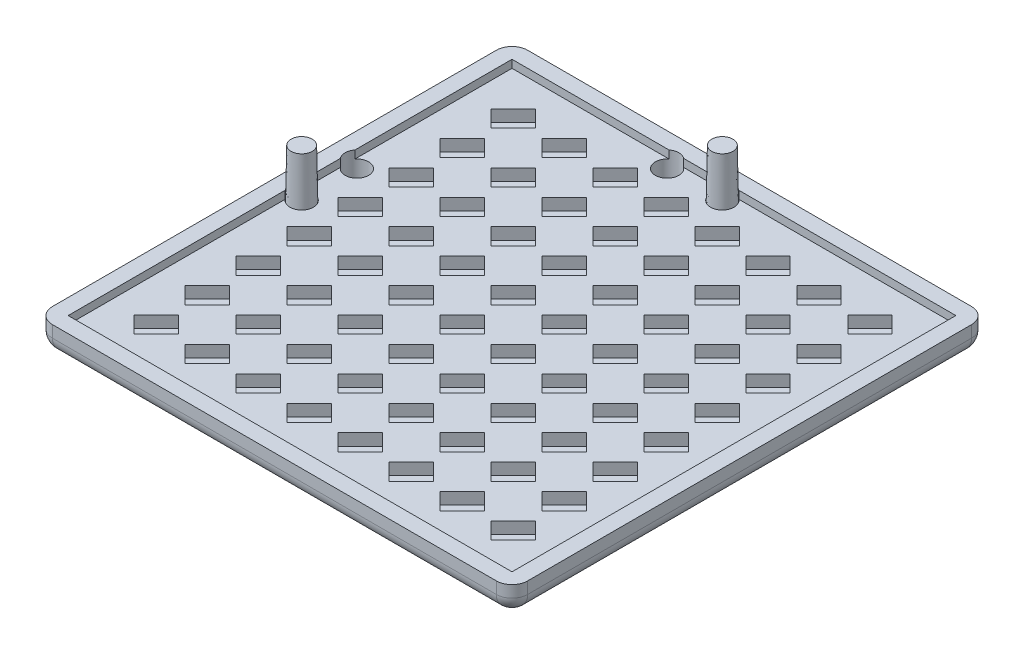
from build123d import *

# Parameters (mm, degrees)
SKETCH1_W                     = 60.6
SKETCH1_H                     = 60.6
BOSS_EXTRUDE1_DEPTH           = 3.5
CUT_EXTRUDE1_START            = -1
CUT_EXTRUDE1_DEPTH            = 42.993371582
CUT_EXTRUDE2_START            = -1
SKETCH3_W                     = 56.6
SKETCH3_H                     = 56.6
CUT_EXTRUDE2_DEPTH            = 44.993371582
SKETCH4_R                     = 1.5
CUT_EXTRUDE3_DEPTH            = 43.993371582
BOSS_EXTRUDE3_START           = -3.5
SKETCH5_R                     = 1.5
BOSS_EXTRUDE3_DEPTH           = 8.6
BOSS_EXTRUDE3_DRAFT           = 1
BOSS_EXTRUDE3_PROFILE_2_DEPTH = 8.6
BOSS_EXTRUDE3_PROFILE_2_DRAFT = 1
FILLET3_R                     = 2
FILLET4_R                     = 2


with BuildPart() as part:
    # Sketch1 → Boss-Extrude1 (new body)
    with BuildSketch(Plane(origin=(0, 0, 0), x_dir=(1, 0, 0), z_dir=(0, 1, 0))):
        Rectangle(SKETCH1_W, SKETCH1_H)
    extrude(amount=BOSS_EXTRUDE1_DEPTH)

    # led → Cut-Extrude1 (cut, through all)
    with BuildSketch(Plane.XZ.offset(CUT_EXTRUDE1_START)):
        Polygon((22.471572875, -20.350252532), (25.3, -23.178679656), (23.178679656, -25.3), (20.350252532, -22.471572875), align=None)
        Polygon((13.850252532, -22.471572875), (16.678679656, -25.3), (18.8, -23.178679656), (15.971572875, -20.350252532), align=None)
        Polygon((7.350252532, -22.471572875), (10.178679656, -25.3), (12.3, -23.178679656), (9.471572875, -20.350252532), align=None)
        Polygon((0.850252532, -22.471572875), (3.678679656, -25.3), (5.8, -23.178679656), (2.971572875, -20.350252532), align=None)
        Polygon((-5.649747468, -22.471572875), (-2.821320344, -25.3), (-0.7, -23.178679656), (-3.528427125, -20.350252532), align=None)
        Polygon((-12.149747468, -22.471572875), (-9.321320344, -25.3), (-7.2, -23.178679656), (-10.028427125, -20.350252532), align=None)
        Polygon((-18.649747468, -22.471572875), (-15.821320344, -25.3), (-13.7, -23.178679656), (-16.528427125, -20.350252532), align=None)
        Polygon((-25.149747468, -22.471572875), (-22.321320344, -25.3), (-20.2, -23.178679656), (-23.028427125, -20.350252532), align=None)
        Polygon((13.850252532, -15.971572875), (16.678679656, -18.8), (18.8, -16.678679656), (15.971572875, -13.850252532), align=None)
        Polygon((7.350252532, -15.971572875), (10.178679656, -18.8), (12.3, -16.678679656), (9.471572875, -13.850252532), align=None)
        Polygon((0.850252532, -15.971572875), (3.678679656, -18.8), (5.8, -16.678679656), (2.971572875, -13.850252532), align=None)
        Polygon((-5.649747468, -15.971572875), (-2.821320344, -18.8), (-0.7, -16.678679656), (-3.528427125, -13.850252532), align=None)
        Polygon((-12.149747468, -15.971572875), (-9.321320344, -18.8), (-7.2, -16.678679656), (-10.028427125, -13.850252532), align=None)
        Polygon((-18.649747468, -15.971572875), (-15.821320344, -18.8), (-13.7, -16.678679656), (-16.528427125, -13.850252532), align=None)
        Polygon((-25.149747468, -15.971572875), (-22.321320344, -18.8), (-20.2, -16.678679656), (-23.028427125, -13.850252532), align=None)
        Polygon((13.850252532, -9.471572875), (16.678679656, -12.3), (18.8, -10.178679656), (15.971572875, -7.350252532), align=None)
        Polygon((7.350252532, -9.471572875), (10.178679656, -12.3), (12.3, -10.178679656), (9.471572875, -7.350252532), align=None)
        Polygon((0.850252532, -9.471572875), (3.678679656, -12.3), (5.8, -10.178679656), (2.971572875, -7.350252532), align=None)
        Polygon((-5.649747468, -9.471572875), (-2.821320344, -12.3), (-0.7, -10.178679656), (-3.528427125, -7.350252532), align=None)
        Polygon((-12.149747468, -9.471572875), (-9.321320344, -12.3), (-7.2, -10.178679656), (-10.028427125, -7.350252532), align=None)
        Polygon((-18.649747468, -9.471572875), (-15.821320344, -12.3), (-13.7, -10.178679656), (-16.528427125, -7.350252532), align=None)
        Polygon((-25.149747468, -9.471572875), (-22.321320344, -12.3), (-20.2, -10.178679656), (-23.028427125, -7.350252532), align=None)
        Polygon((13.850252532, -2.971572875), (16.678679656, -5.8), (18.8, -3.678679656), (15.971572875, -0.850252532), align=None)
        Polygon((7.350252532, -2.971572875), (10.178679656, -5.8), (12.3, -3.678679656), (9.471572875, -0.850252532), align=None)
        Polygon((0.850252532, -2.971572875), (3.678679656, -5.8), (5.8, -3.678679656), (2.971572875, -0.850252532), align=None)
        Polygon((-5.649747468, -2.971572875), (-2.821320344, -5.8), (-0.7, -3.678679656), (-3.528427125, -0.850252532), align=None)
        Polygon((-12.149747468, -2.971572875), (-9.321320344, -5.8), (-7.2, -3.678679656), (-10.028427125, -0.850252532), align=None)
        Polygon((-18.649747468, -2.971572875), (-15.821320344, -5.8), (-13.7, -3.678679656), (-16.528427125, -0.850252532), align=None)
        Polygon((-25.149747468, -2.971572875), (-22.321320344, -5.8), (-20.2, -3.678679656), (-23.028427125, -0.850252532), align=None)
        Polygon((13.850252532, 3.528427125), (16.678679656, 0.7), (18.8, 2.821320344), (15.971572875, 5.649747468), align=None)
        Polygon((7.350252532, 3.528427125), (10.178679656, 0.7), (12.3, 2.821320344), (9.471572875, 5.649747468), align=None)
        Polygon((0.850252532, 3.528427125), (3.678679656, 0.7), (5.8, 2.821320344), (2.971572875, 5.649747468), align=None)
        Polygon((-5.649747468, 3.528427125), (-2.821320344, 0.7), (-0.7, 2.821320344), (-3.528427125, 5.649747468), align=None)
        Polygon((-12.149747468, 3.528427125), (-9.321320344, 0.7), (-7.2, 2.821320344), (-10.028427125, 5.649747468), align=None)
        Polygon((-18.649747468, 3.528427125), (-15.821320344, 0.7), (-13.7, 2.821320344), (-16.528427125, 5.649747468), align=None)
        Polygon((-25.149747468, 3.528427125), (-22.321320344, 0.7), (-20.2, 2.821320344), (-23.028427125, 5.649747468), align=None)
        Polygon((13.850252532, 10.028427125), (16.678679656, 7.2), (18.8, 9.321320344), (15.971572875, 12.149747468), align=None)
        Polygon((7.350252532, 10.028427125), (10.178679656, 7.2), (12.3, 9.321320344), (9.471572875, 12.149747468), align=None)
        Polygon((0.850252532, 10.028427125), (3.678679656, 7.2), (5.8, 9.321320344), (2.971572875, 12.149747468), align=None)
        Polygon((-5.649747468, 10.028427125), (-2.821320344, 7.2), (-0.7, 9.321320344), (-3.528427125, 12.149747468), align=None)
        Polygon((-12.149747468, 10.028427125), (-9.321320344, 7.2), (-7.2, 9.321320344), (-10.028427125, 12.149747468), align=None)
        Polygon((-18.649747468, 10.028427125), (-15.821320344, 7.2), (-13.7, 9.321320344), (-16.528427125, 12.149747468), align=None)
        Polygon((-25.149747468, 10.028427125), (-22.321320344, 7.2), (-20.2, 9.321320344), (-23.028427125, 12.149747468), align=None)
        Polygon((13.850252532, 16.528427125), (16.678679656, 13.7), (18.8, 15.821320344), (15.971572875, 18.649747468), align=None)
        Polygon((7.350252532, 16.528427125), (10.178679656, 13.7), (12.3, 15.821320344), (9.471572875, 18.649747468), align=None)
        Polygon((0.850252532, 16.528427125), (3.678679656, 13.7), (5.8, 15.821320344), (2.971572875, 18.649747468), align=None)
        Polygon((-5.649747468, 16.528427125), (-2.821320344, 13.7), (-0.7, 15.821320344), (-3.528427125, 18.649747468), align=None)
        Polygon((-12.149747468, 16.528427125), (-9.321320344, 13.7), (-7.2, 15.821320344), (-10.028427125, 18.649747468), align=None)
        Polygon((-18.649747468, 16.528427125), (-15.821320344, 13.7), (-13.7, 15.821320344), (-16.528427125, 18.649747468), align=None)
        Polygon((-25.149747468, 16.528427125), (-22.321320344, 13.7), (-20.2, 15.821320344), (-23.028427125, 18.649747468), align=None)
        Polygon((13.850252532, 23.028427125), (16.678679656, 20.2), (18.8, 22.321320344), (15.971572875, 25.149747468), align=None)
        Polygon((7.350252532, 23.028427125), (10.178679656, 20.2), (12.3, 22.321320344), (9.471572875, 25.149747468), align=None)
        Polygon((0.850252532, 23.028427125), (3.678679656, 20.2), (5.8, 22.321320344), (2.971572875, 25.149747468), align=None)
        Polygon((-5.649747468, 23.028427125), (-2.821320344, 20.2), (-0.7, 22.321320344), (-3.528427125, 25.149747468), align=None)
        Polygon((-12.149747468, 23.028427125), (-9.321320344, 20.2), (-7.2, 22.321320344), (-10.028427125, 25.149747468), align=None)
        Polygon((-18.649747468, 23.028427125), (-15.821320344, 20.2), (-13.7, 22.321320344), (-16.528427125, 25.149747468), align=None)
        Polygon((-25.149747468, 23.028427125), (-22.321320344, 20.2), (-20.2, 22.321320344), (-23.028427125, 25.149747468), align=None)
        Polygon((20.350252532, -15.971572875), (23.178679656, -18.8), (25.3, -16.678679656), (22.471572875, -13.850252532), align=None)
        Polygon((20.350252532, -9.471572875), (23.178679656, -12.3), (25.3, -10.178679656), (22.471572875, -7.350252532), align=None)
        Polygon((20.350252532, -2.971572875), (23.178679656, -5.8), (25.3, -3.678679656), (22.471572875, -0.850252532), align=None)
        Polygon((20.350252532, 3.528427125), (23.178679656, 0.7), (25.3, 2.821320344), (22.471572875, 5.649747468), align=None)
        Polygon((20.350252532, 10.028427125), (23.178679656, 7.2), (25.3, 9.321320344), (22.471572875, 12.149747468), align=None)
        Polygon((20.350252532, 16.528427125), (23.178679656, 13.7), (25.3, 15.821320344), (22.471572875, 18.649747468), align=None)
        Polygon((20.350252532, 23.028427125), (23.178679656, 20.2), (25.3, 22.321320344), (22.471572875, 25.149747468), align=None)
    extrude(amount=-CUT_EXTRUDE1_DEPTH, mode=Mode.SUBTRACT)

    # Sketch3 → Cut-Extrude2 (cut, through all)
    with BuildSketch(Plane(origin=(0, 3.5, 0), x_dir=(1, 0, 0), z_dir=(0, 1, 0)).offset(CUT_EXTRUDE2_START)):
        Rectangle(SKETCH3_W, SKETCH3_H)
    extrude(amount=CUT_EXTRUDE2_DEPTH, mode=Mode.SUBTRACT)

    # Sketch4 → Cut-Extrude3 (cut, through all)
    with BuildSketch(Plane(origin=(0, 3.5, 0), x_dir=(1, 0, 0), z_dir=(0, 1, 0))):
        with Locations(Location((-0.3, 27.12, 0), (0, 0, 270))):
            Circle(SKETCH4_R)
        with Locations(Location((-7.34, 27.12, 0), (0, 0, 270))):
            Circle(SKETCH4_R)
        with Locations(Location((-27.12, 7.34, 0), (0, 0, 218.124911622))):
            Circle(SKETCH4_R)
        with Locations(Location((-27.12, 0.3, 0), (0, 0, 218.124911622))):
            Circle(SKETCH4_R)
    extrude(amount=-CUT_EXTRUDE3_DEPTH, mode=Mode.SUBTRACT)

    # Fillet3
    fillet3_edges = [part.edges().sort_by_distance(p)[0] for p in [
        (30.3, 1.75, 30.3),
        (-30.3, 1.75, 30.3),
        (-30.3, 1.75, -30.3),
        (30.3, 1.75, -30.3),
    ]]
    fillet(fillet3_edges, radius=FILLET3_R)

    # Fillet4
    # the kernel refuses this fillet: 2 mm, written as the material it takes off along each edge
    with BuildSketch(Plane(origin=(-28.3, 0, 30.3), x_dir=(0, 1, 0), z_dir=(1, 0, 0))) as fillet4_piece_1:
        with BuildLine():
            CenterArc((FILLET4_R, -FILLET4_R), FILLET4_R, 90, 90)
            Line((0, -FILLET4_R), (0, 0))
            Line((0, 0), (FILLET4_R, 0))
        make_face()
    extrude(amount=56.6, mode=Mode.SUBTRACT)
    with BuildSketch(Plane(origin=(30.3, 0, 28.3), x_dir=(-1, 0, 0), z_dir=(0, 0, -1)), Plane(origin=(-30.3, 0, -28.3), x_dir=(1, 0, 0), z_dir=(0, 0, 1)), Plane(origin=(28.3, 0, -30.3), x_dir=(0, 0, 1), z_dir=(-1, 0, 0))) as fillet4_piece_2:
        with BuildLine():
            CenterArc((FILLET4_R, FILLET4_R), FILLET4_R, 180, 90)
            Line((0, FILLET4_R), (0, 0))
            Line((0, 0), (FILLET4_R, 0))
        make_face()
    extrude(amount=56.6, mode=Mode.SUBTRACT)
    with BuildSketch(Plane(origin=(28.3, 0, 28.3), x_dir=(0, 0, 1), z_dir=(-1, 0, 0))) as fillet4_piece_3:
        with BuildLine():
            CenterArc((2 - FILLET4_R, FILLET4_R), FILLET4_R, 270, 90)
            Line((2, FILLET4_R), (2, 0))
            Line((2, 0), (2 - FILLET4_R, 0))
        make_face()
    revolve(axis=Axis((28.3, 0, 28.3), (0, 1, 0)), revolution_arc=90, mode=Mode.SUBTRACT)
    with BuildSketch(Plane(origin=(28.3, 0, -28.3), x_dir=(1, 0, 0), z_dir=(0, 0, 1))) as fillet4_piece_4:
        with BuildLine():
            CenterArc((2 - FILLET4_R, FILLET4_R), FILLET4_R, 270, 90)
            Line((2, FILLET4_R), (2, 0))
            Line((2, 0), (2 - FILLET4_R, 0))
        make_face()
    revolve(axis=Axis((28.3, 0, -28.3), (0, 1, 0)), revolution_arc=90, mode=Mode.SUBTRACT)
    with BuildSketch(Plane(origin=(-28.3, 0, -28.3), x_dir=(-1, 0, 0), z_dir=(0, 0, 1))) as fillet4_piece_5:
        with BuildLine():
            CenterArc((2 - FILLET4_R, -FILLET4_R), FILLET4_R, 0, 90)
            Line((2, -FILLET4_R), (2, 0))
            Line((2, 0), (2 - FILLET4_R, 0))
        make_face()
    revolve(axis=Axis((-28.3, 0, -28.3), (0, -1, 0)), revolution_arc=90, mode=Mode.SUBTRACT)
    with BuildSketch(Plane(origin=(-28.3, 0, 28.3), x_dir=(0, 0, 1), z_dir=(1, 0, 0))) as fillet4_piece_6:
        with BuildLine():
            CenterArc((2 - FILLET4_R, -FILLET4_R), FILLET4_R, 0, 90)
            Line((2, -FILLET4_R), (2, 0))
            Line((2, 0), (2 - FILLET4_R, 0))
        make_face()
    revolve(axis=Axis((-28.3, 0, 28.3), (0, -1, 0)), revolution_arc=90, mode=Mode.SUBTRACT)


with BuildPart() as body_2:
    # Sketch5 → Boss-Extrude3 (with draft: the straight prism first)
    with BuildSketch(Plane(origin=(0, 3.5, 0), x_dir=(1, 0, 0), z_dir=(0, 1, 0)).offset(BOSS_EXTRUDE3_START)):
        with Locations(Location((-27.12, 0.3, 0), (0, 0, 218.124911622))):
            Circle(SKETCH5_R)
    extrude(amount=BOSS_EXTRUDE3_DEPTH)
    # Boss-Extrude3: the draft: its side faces are tilted about the plane it starts from
    boss_extrude3_sides = [body_2.faces().sort_by_distance(p)[0] for p in [
        (-25.94, 4.3, -1.226066952),
    ]]
    draft(boss_extrude3_sides, Plane(origin=(0, 3.5, 0), x_dir=(1, 0, 0), z_dir=(0, 1, 0)).offset(BOSS_EXTRUDE3_START), BOSS_EXTRUDE3_DRAFT)


with BuildPart() as body_3:
    # Sketch5 → Boss-Extrude3 profile 2 (with draft: the straight prism first)
    with BuildSketch(Plane(origin=(0, 3.5, 0), x_dir=(1, 0, 0), z_dir=(0, 1, 0)).offset(BOSS_EXTRUDE3_START)):
        with Locations(Location((-0.3, 27.12, 0), (0, 0, 270))):
            Circle(SKETCH5_R)
    extrude(amount=BOSS_EXTRUDE3_PROFILE_2_DEPTH)
    # Boss-Extrude3 profile 2: the draft: its side faces are tilted about the plane it starts from
    boss_extrude3_profile_2_sides = [body_3.faces().sort_by_distance(p)[0] for p in [
        (-0.3, 4.3, -28.62),
    ]]
    draft(boss_extrude3_profile_2_sides, Plane(origin=(0, 3.5, 0), x_dir=(1, 0, 0), z_dir=(0, 1, 0)).offset(BOSS_EXTRUDE3_START), BOSS_EXTRUDE3_PROFILE_2_DRAFT)


solid = Compound([part.part, body_2.part, body_3.part])
